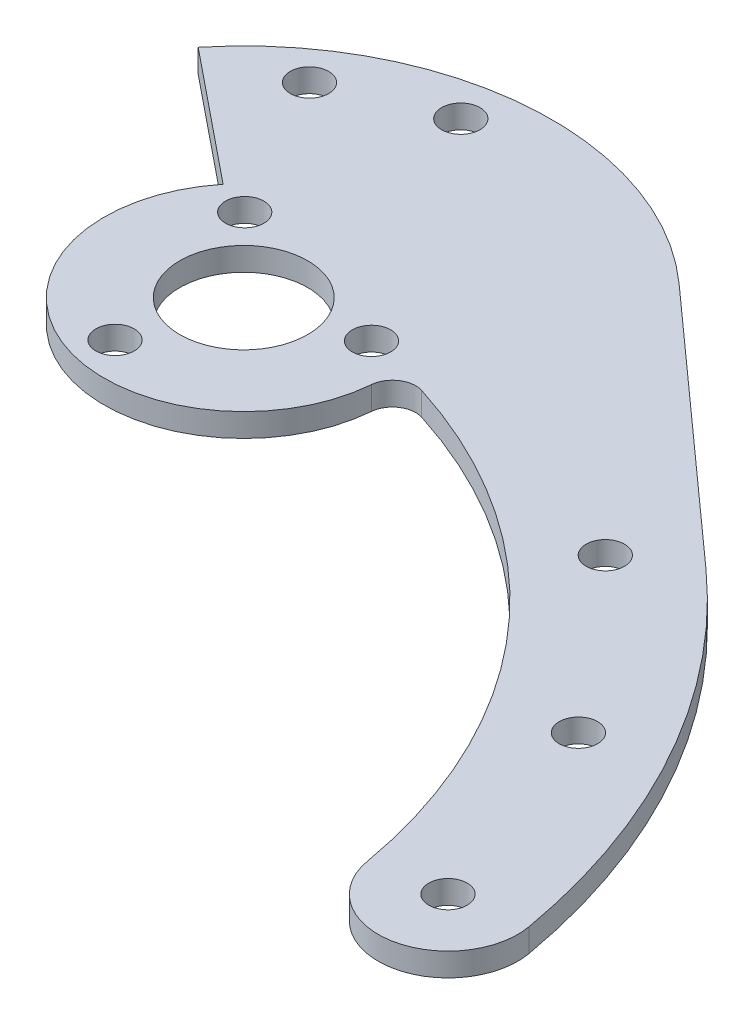
from build123d import *

# Parameters (mm, degrees)
SKETCH_1_R          = 1.65
SKETCH_1_R_2        = 5.5
EXTRUDE_1_DEPTH     = 2
SKETCH_2_R          = 1.65
CUT_EXTRUDE_2_DEPTH = 73.378330115
FILLET_1_R          = 2


with BuildPart() as part:
    # Эскиз1 → Бобышка-Вытянуть1 (new body)
    with BuildSketch(Plane(origin=(0, 0, 0), x_dir=(1, 0, 0), z_dir=(0, 1, 0))):
        with BuildLine():
            Line((-9.325751537, 7.551844693), (-20.594367979, 16.676990363))
            ThreePointArc((-20.594367979, 16.676990363), (-11.408544065, 23.918510035), (0, 26.5))
            ThreePointArc((0, 26.5), (9.472405203, 24.74921291), (17.693175332, 19.728191673))
            Line((17.693175332, 19.728191673), (40.060019619, -0.331452118))
            ThreePointArc((40.060019619, -0.331452118), (52.448537608, -15.858861968), (59.088465181, -34.580165246))
            ThreePointArc((59.088465181, -34.580165246), (54.221507729, -41.53090083), (47.270772145, -36.663943378))
            ThreePointArc((47.270772145, -36.663943378), (35.208034426, -12.373999402), (11.905757948, 1.500975575))
            ThreePointArc((11.905757948, 1.500975575), (-3.288975911, -11.540478216), (-9.325751537, 7.551844693))
        make_face()
        with Locations((-6.322604321, 6.40505071)):
            Circle(SKETCH_1_R, mode=Mode.SUBTRACT)
        Circle(SKETCH_1_R_2, mode=Mode.SUBTRACT)
        with Locations((8.708238788, 2.273010605)):
            Circle(SKETCH_1_R, mode=Mode.SUBTRACT)
        with Locations((-2.385634467, -8.678061315)):
            Circle(SKETCH_1_R, mode=Mode.SUBTRACT)
    extrude(amount=EXTRUDE_1_DEPTH)

    # Эскиз2 → Вырез-Вытянуть2 (cut, through all)
    with BuildSketch(Plane(origin=(0, 2, 0), x_dir=(1, 0, 0), z_dir=(0, 1, 0))):
        with Locations((-3.993908086, 22.650578319)):
            Circle(SKETCH_2_R)
        with Locations((-13.192258036, 18.840497019)):
            Circle(SKETCH_2_R)
        with Locations((46.765371804, -18)):
            Circle(SKETCH_2_R)
        with Locations((53.179618663, -35.622998406)):
            Circle(SKETCH_2_R)
        with Locations((34.710530923, -3.633600072)):
            Circle(SKETCH_2_R)
    extrude(amount=-CUT_EXTRUDE_2_DEPTH, mode=Mode.SUBTRACT)

    # Скругление1
    fillet_1_edges = [part.edges().sort_by_distance(p)[0] for p in [
        (11.905757948, 1, -1.500975575),
    ]]
    fillet(fillet_1_edges, radius=FILLET_1_R)


solid = part.part
